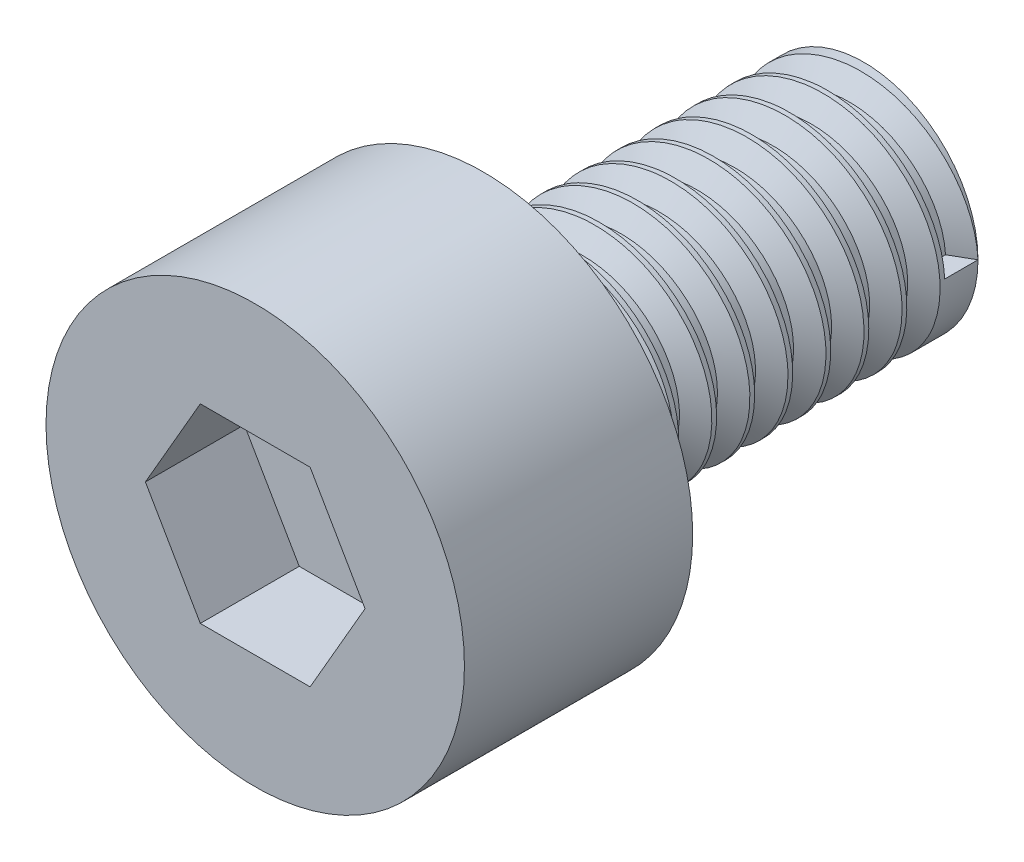
from build123d import *

# Parameters (mm, degrees)
SKETCH1_R              = 1.5
BOSS_EXTRUDE1_DEPTH    = 5
SKETCH2_R              = 2.75
BOSS_EXTRUDE2_DEPTH    = 3
CUT_EXTRUDE1_DEPTH     = 1.3
REN_NGOAI_M3X0_5_PITCH = 0.5


with BuildPart() as part:
    # Sketch1 → Boss-Extrude1 (new body)
    with BuildSketch(Plane.XY):
        Circle(SKETCH1_R)
    extrude(amount=-BOSS_EXTRUDE1_DEPTH)

    # Sketch2 → Boss-Extrude2 (add)
    with BuildSketch(Plane.XY):
        Circle(SKETCH2_R)
    extrude(amount=BOSS_EXTRUDE2_DEPTH)

    # Sketch3 → Cut-Extrude1 (cut)
    with BuildSketch(Plane.XY.offset(3)):
        Polygon((1.443375673, 0), (0.721687836, 1.25), (-0.721687836, 1.25), (-1.443375673, 0), (-0.721687836, -1.25), (0.721687836, -1.25), align=None)
    extrude(amount=-CUT_EXTRUDE1_DEPTH, mode=Mode.SUBTRACT)

    # Ren_ngoai_M3x0_5: the profile of Thread Profile1 profile screwed along a right-hand helix of 10 turns, 6 arcs to a turn; built about Z, then put on its axis
    ren_ngoai_m3x0_5_z = Axis((0, 0, 0), (0, 0, 1))
    ren_ngoai_m3x0_5_corners = [(1.5003, 0, -0.000173205), (1.5003, 0, 0.437673204), (1.229367063, 0, 0.281249999), (1.229367062, 0, 0.156249999)]
    with BuildLine(mode=Mode.PRIVATE) as ren_ngoai_m3x0_5_profile:
        Line(ren_ngoai_m3x0_5_corners[0], ren_ngoai_m3x0_5_corners[1])
        Line(ren_ngoai_m3x0_5_corners[1], ren_ngoai_m3x0_5_corners[2])
        Line(ren_ngoai_m3x0_5_corners[2], ren_ngoai_m3x0_5_corners[3])
        Line(ren_ngoai_m3x0_5_corners[3], ren_ngoai_m3x0_5_corners[0])
    ren_ngoai_m3x0_5_cap = Face(ren_ngoai_m3x0_5_profile.wire())
    ren_ngoai_m3x0_5_turn_angles = [0, 30, 60, 90, 120, 150, 180, 210, 240, 270, 300, 330, 360]
    ren_ngoai_m3x0_5_turn_weights = [1, 0.8660254037844387, 1, 0.8660254037844387, 1, 0.8660254037844387, 1, 0.8660254037844387, 1, 0.8660254037844387, 1, 0.8660254037844387, 1]
    ren_ngoai_m3x0_5_turn_rails = [Edge.make_bspline([Vector(p[0], p[1], 0).rotate(ren_ngoai_m3x0_5_z, ren_ngoai_m3x0_5_turn_angles[k]) / ren_ngoai_m3x0_5_turn_weights[k] + Vector(0, 0, p[2] + REN_NGOAI_M3X0_5_PITCH * ren_ngoai_m3x0_5_turn_angles[k] / 360) for k in range(13)], [0, 0, 0, 1, 1, 2, 2, 3, 3, 4, 4, 5, 5, 6, 6, 6], 2, ren_ngoai_m3x0_5_turn_weights) for p in ren_ngoai_m3x0_5_corners]
    ren_ngoai_m3x0_5_turn_sides = [Face.make_surface_from_curves(ren_ngoai_m3x0_5_turn_rails[p[0]], ren_ngoai_m3x0_5_turn_rails[p[1]]) for p in [(0, 1), (1, 2), (2, 3), (3, 0)]]
    ren_ngoai_m3x0_5 = Plane(origin=(0, 0, -5), x_dir=(1, 0, 0), z_dir=(0, 0, 1)) * Solid(Shell([*[p.moved(Location((0, 0, REN_NGOAI_M3X0_5_PITCH * i))) for i in range(10) for p in ren_ngoai_m3x0_5_turn_sides], ren_ngoai_m3x0_5_cap, ren_ngoai_m3x0_5_cap.rotate(ren_ngoai_m3x0_5_z, 3600).moved(Location((0, 0, REN_NGOAI_M3X0_5_PITCH * 3600 / 360)))]))
    add(ren_ngoai_m3x0_5, mode=Mode.SUBTRACT)


solid = part.part
